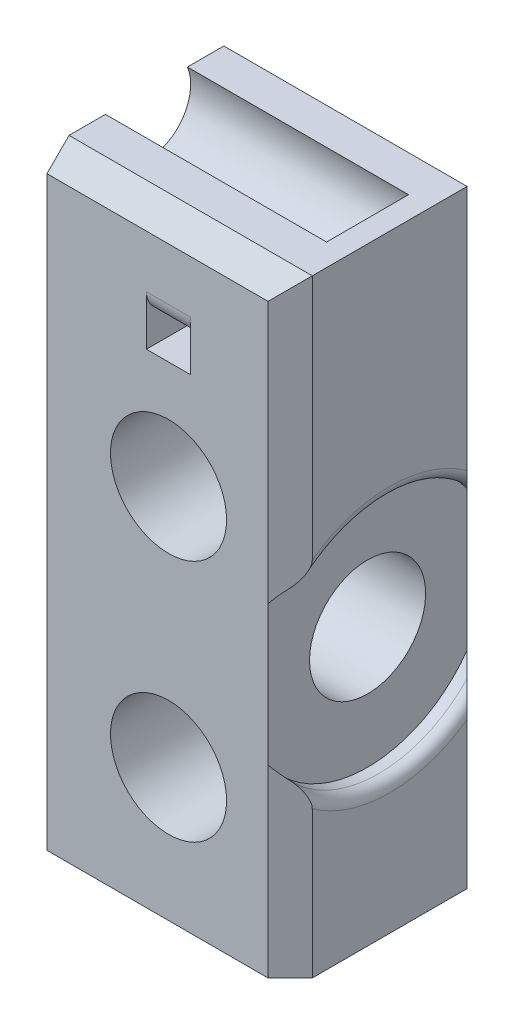
from build123d import *

# Parameters (mm, degrees)
SKETCH1_W           = 22
SKETCH1_H           = 55
SKETCH1_R           = 5.25
SKETCH1_W_2         = 4
SKETCH1_H_2         = 2.5
BOSS_EXTRUDE1_DEPTH = 18
SKETCH2_R           = 5.25
CUT_EXTRUDE1_DEPTH  = 62.911226769
SKETCH3_R           = 4
CUT_EXTRUDE2_DEPTH  = 20
CHAMFER1_SIZE       = 2
SKETCH4_R           = 11
CUT_EXTRUDE3_DEPTH  = 2
FILLET1_R           = 1
CHAMFER2_SIZE       = 2
FILLET2_R           = 2


with BuildPart() as part:
    # Sketch1 → Boss-Extrude1 (new body)
    with BuildSketch(Plane.XY):
        with Locations((11, 27.5)):
            Rectangle(SKETCH1_W, SKETCH1_H)
        with Locations((11, 12)):
            Circle(SKETCH1_R, mode=Mode.SUBTRACT)
        with Locations((11, 34)):
            Circle(SKETCH1_R, mode=Mode.SUBTRACT)
        with Locations((11, 45)):
            Rectangle(SKETCH1_W_2, SKETCH1_H_2, mode=Mode.SUBTRACT)
    extrude(amount=-BOSS_EXTRUDE1_DEPTH)

    # Sketch2 → Cut-Extrude1 (cut, through all)
    with BuildSketch(Plane.ZY):
        with Locations((-9, 23)):
            Circle(SKETCH2_R)
    extrude(amount=-CUT_EXTRUDE1_DEPTH, mode=Mode.SUBTRACT)

    # Sketch3 → Cut-Extrude2 (cut)
    with BuildSketch(Plane(origin=(0, 0, 0), x_dir=(0, 0, -1), z_dir=(1, 0, 0))):
        with Locations((9, 53.5)):
            Circle(SKETCH3_R)
    extrude(amount=CUT_EXTRUDE2_DEPTH, mode=Mode.SUBTRACT)

    # Chamfer1
    chamfer1_edges = [part.edges().sort_by_distance(p)[0] for p in [
        (22, 27.5, 0),
        (22, 27.5, -18),
    ]]
    chamfer(chamfer1_edges, length=CHAMFER1_SIZE)

    # Sketch4 → Cut-Extrude3 (cut)
    with BuildSketch(Plane(origin=(22, 0, 0), x_dir=(0, 0, -1), z_dir=(1, 0, 0))):
        with Locations((9, 23)):
            Circle(SKETCH4_R)
    extrude(amount=-CUT_EXTRUDE3_DEPTH, mode=Mode.SUBTRACT)

    # Fillet1
    fillet1_edges = [part.edges().sort_by_distance(p)[0] for p in [
        (22, 34, -9),
        (22, 12, -9),
    ]]
    fillet(fillet1_edges, radius=FILLET1_R)

    # Chamfer2
    chamfer2_edges = [part.edges().sort_by_distance(p)[0] for p in [
        (10, 55, 0),
        (10, 55, -18),
    ]]
    chamfer(chamfer2_edges, length=CHAMFER2_SIZE)

    # Fillet2
    fillet2_edges = [part.edges().sort_by_distance(p)[0] for p in [
        (11, 46.25, -18),
        (11, 46.25, 0),
    ]]
    fillet(fillet2_edges, radius=FILLET2_R)


solid = part.part
